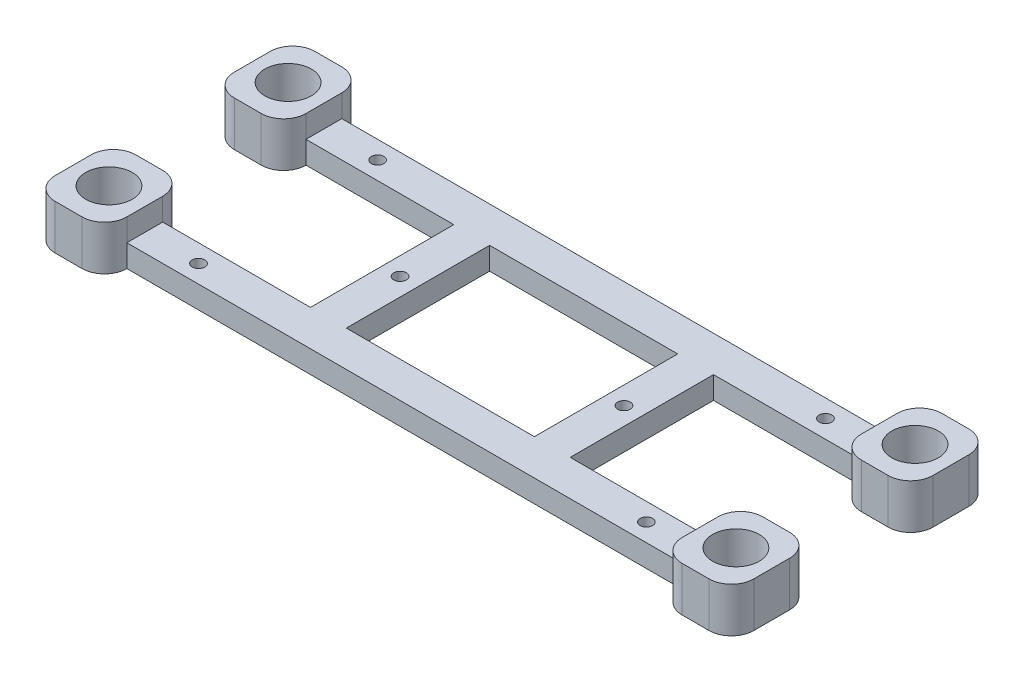
from build123d import *

# Parameters (mm, degrees)
SKETCH1_R           = 5.2
SKETCH1_R_2         = 1.4
BOSS_EXTRUDE1_DEPTH = 10
SKETCH2_W           = 124
SKETCH2_H           = 5
CUT_EXTRUDE1_DEPTH  = 158.353106102
FILLET1_R           = 5
SKETCH3_W           = 8
SKETCH3_H           = 32
BOSS_EXTRUDE2_DEPTH = 5
SKETCH4_R           = 1.4
CUT_EXTRUDE2_DEPTH  = 162.124175716


with BuildPart() as part:
    # Sketch1 → Boss-Extrude1 (new body)
    with BuildSketch(Plane(origin=(0, 0, 0), x_dir=(1, 0, 0), z_dir=(0, 1, 0))):
        Polygon((0, 0), (16, 0), (16, 5), (140, 5), (140, 0), (156, 0), (156, 18), (140, 18), (140, 13), (16, 13), (16, 18), (0, 18), align=None)
        with Locations(Location((8, 9, 0), (0, 0, 270))):
            Circle(SKETCH1_R, mode=Mode.SUBTRACT)
        with Locations(Location((148, 9, 0), (0, 0, 270))):
            Circle(SKETCH1_R, mode=Mode.SUBTRACT)
        with Locations(Location((28, 9, 0), (0, 0, 270))):
            Circle(SKETCH1_R_2, mode=Mode.SUBTRACT)
        with Locations(Location((128, 9, 0), (0, 0, 90))):
            Circle(SKETCH1_R_2, mode=Mode.SUBTRACT)
    extrude(amount=BOSS_EXTRUDE1_DEPTH)

    # Sketch2 → Cut-Extrude1 (cut, through all)
    with BuildSketch(Plane.XY):
        with Locations((78, 7.5)):
            Rectangle(SKETCH2_W, SKETCH2_H)
    extrude(amount=-CUT_EXTRUDE1_DEPTH, mode=Mode.SUBTRACT)

    # Fillet1
    fillet1_edges = [part.edges().sort_by_distance(p)[0] for p in [
        (140, 5, 0),
        (156, 5, 0),
        (156, 5, -18),
        (140, 5, -18),
        (0, 5, 0),
        (0, 5, -18),
        (16, 5, -18),
        (16, 5, 0),
    ]]
    fillet(fillet1_edges, radius=FILLET1_R - 0.0001)  # a hair under: the kernel refuses the full size


with BuildPart() as body_2:
    # Body-Move/Copy1: copy of part
    add(part.part.moved(Location((0, 0, 40))))


with BuildPart() as part_1:
    add(part.part)

    add(body_2.part)  # Boss-Extrude2 merges body 2
    # Sketch3 → Boss-Extrude2 (add)
    with BuildSketch(Plane(origin=(0, 0, 0), x_dir=(1, 0, 0), z_dir=(0, 1, 0))):
        with Locations((53, -11)):
            Rectangle(SKETCH3_W, SKETCH3_H)
        with Locations((103, -11)):
            Rectangle(SKETCH3_W, SKETCH3_H)
    extrude(amount=BOSS_EXTRUDE2_DEPTH)

    # Sketch4 → Cut-Extrude2 (cut, through all)
    with BuildSketch(Plane(origin=(0, 5, 0), x_dir=(1, 0, 0), z_dir=(0, 1, 0))):
        with Locations(Location((53, -11, 0), (0, 0, 270))):
            Circle(SKETCH4_R)
        with Locations(Location((103, -11, 0), (0, 0, 270))):
            Circle(SKETCH4_R)
    extrude(amount=-CUT_EXTRUDE2_DEPTH, mode=Mode.SUBTRACT)


solid = part_1.part
